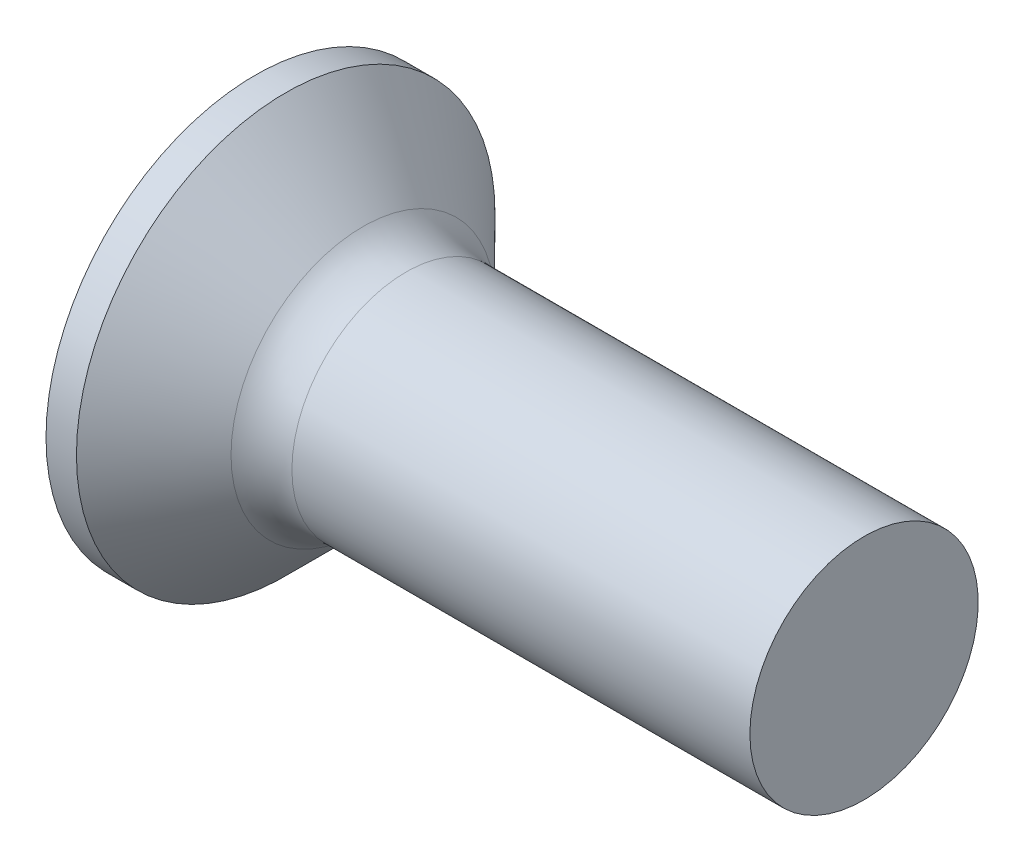
from build123d import *

# Parameters (mm, degrees)
FILLET1_R    = 0.8
RECPAT_COUNT = 2
RECPAT_ANGLE = 90


with BuildPart() as part:
    # BodySke → Base-Revolve (revolve)
    with BuildSketch(Plane.XY):
        Polygon((0, 0), (0, 2.75), (0.4, 2.75), (1.65, 1.5), (8, 1.5), (8, 0), align=None)
    revolve(axis=Axis((-6.35, 0, 0), (1, 0, 0)))

    # Fillet1
    fillet1_edges = [part.edges().sort_by_distance(p)[0] for p in [
        (1.65, -1.5, 0),
    ]]
    fillet(fillet1_edges, radius=FILLET1_R)

    # Sketch3 → Recess section 0
    with BuildSketch(Plane.ZY):
        with BuildLine():
            Line((-0.37, 1.5), (0.37, 1.5))
            Line((0.37, 1.5), (0.37, -1.5))
            Line((0.37, -1.5), (-0.37, -1.5))
            Line((-0.37, -1.5), (-0.37, 1.5))
        make_face()
    # Sketch4 → Recess section 1
    with BuildSketch(Plane.ZY.offset(-2.01)):
        with BuildLine():
            Line((-0.37, 0.497851135), (0.37, 0.497851135))
            Line((0.37, 0.497851135), (0.37, -0.497851135))
            Line((0.37, -0.497851135), (-0.37, -0.497851135))
            Line((-0.37, -0.497851135), (-0.37, 0.497851135))
        make_face()
    recess = loft(mode=Mode.SUBTRACT)

    # RecPat: Recess ×2 about axis
    recpat_axis = Axis((-6.35, 0, 0), (1, 0, 0))
    for i in range(1, RECPAT_COUNT):
        add(recess.rotate(recpat_axis, i * RECPAT_ANGLE / (RECPAT_COUNT - 1)), mode=Mode.SUBTRACT)

    # RecCorSke → RecessCore (revolve, cut)
    with BuildSketch(Plane.XY):
        Polygon((0, 0), (0, 0.696552892), (2.01, 0.556), (2.190655351, 0), align=None)
    revolve(axis=Axis((-3.175, 0, 0), (1, 0, 0)), mode=Mode.SUBTRACT)


solid = part.part
